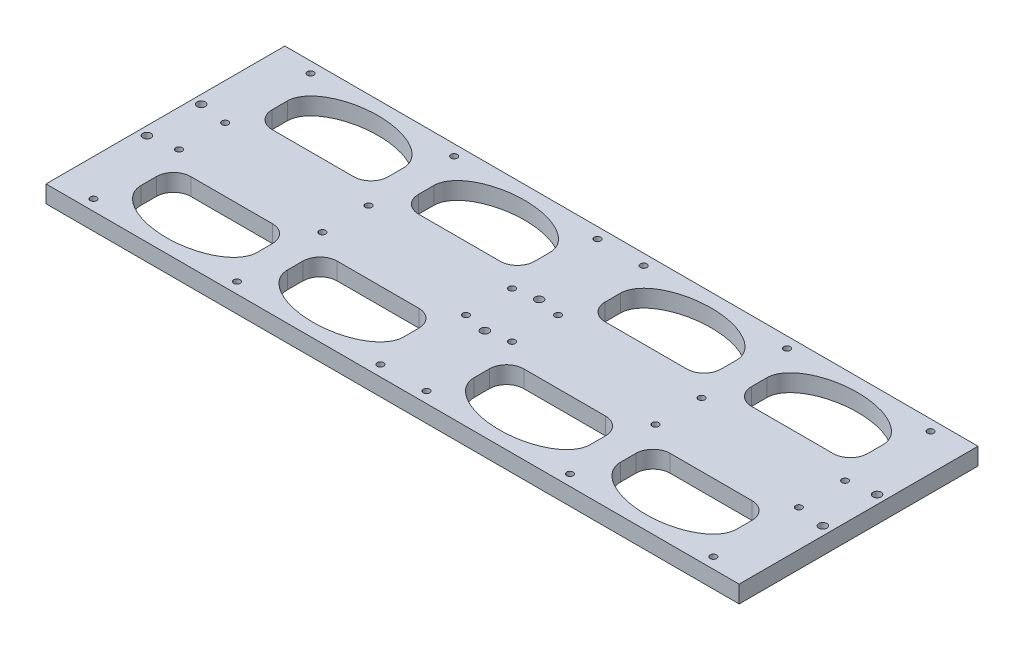
from build123d import *

# Parameters (mm, degrees)
SKETCH4_W                      = 118.3
SKETCH4_H                      = 40.5
BOSS_EXTRUDE1_DEPTH            = 12.7
CUT_EXTRUDE1_DEPTH             = 75.078168174
FILLET1_R                      = 3.175
LPATTERN1_COUNT                = 2
LPATTERN1_PITCH                = 27
FILLET1_OF_LPATTERN1_R         = 3.175
MIRROR1_DEPTH                  = 12.7
SKETCH8_R                      = 0.85
CUT_EXTRUDE2_DEPTH             = 75.078168329
MIRROR3_COPY_1_SKETCH_R        = 0.85
MIRROR3_COPY_1_DEPTH           = 75.078168329
SKETCH14_W                     = 118.3
SKETCH14_H                     = 0.96
SKETCH14_W_2                   = 4.5
SKETCH14_H_2                   = 40.5
CUT_EXTRUDE7_DEPTH             = 0.1
CUT_EXTRUDE8_DEPTH             = 2.35
MIRROR14_COPY_1_DEPTH          = 2.35
MIRROR16_COPY_1_DEPTH          = 2.35
MIRROR16_COPY_2_DEPTH          = 2.35
MIRROR16_COPY_3_DEPTH          = 2.35
CUT_EXTRUDE10_DEPTH            = 75.061089804
SKETCH20_W                     = 127.8
SKETCH20_H                     = 85.5
BOSS_EXTRUDE2_DEPTH            = 3.175
SKETCH22_W                     = 127.8
SKETCH22_H                     = 85.5
CUT_EXTRUDE11_DEPTH            = 78.923440062
CUT_EXTRUDE12_DEPTH            = 77.947080029
F_0_80_TAPPED_HOLE1_D          = 1.19126
MIRROR19_COPY_1_DEPTH          = 77.947080029
MIRROR19_COPY_2_D              = 1.19126
SKETCH26_W                     = 127.8
SKETCH26_H                     = 0.96
CUT_EXTRUDE13_DEPTH            = 3.175
SKETCH27_W                     = 127.8
SKETCH27_H                     = 0.96
CUT_EXTRUDE14_DEPTH            = 3.175
SKETCH29_W                     = 3.175
SKETCH29_H                     = 19.77
CUT_EXTRUDE15_DEPTH            = 0.82
F_1_64_TAPPED_HOLE1_AT_2_COUNT = 2
F_1_64_TAPPED_HOLE1_AT_2_PITCH = 10
SKETCH36_R                     = 0.8
CUT_EXTRUDE16_DEPTH            = 10
FILLET2_R                      = 1.5
FILLET3_R                      = 1.5
F_1_64_TAPPED_HOLE2_AT_2_COUNT = 2
F_1_64_TAPPED_HOLE2_AT_2_PITCH = 10
SKETCH39_W                     = 133.05709145
SKETCH39_H                     = 28.467786801
SKETCH39_W_2                   = 140.708632386
SKETCH39_H_2                   = 27.431216522
CUT_EXTRUDE17_DEPTH            = 10


# Read off the part's stored shape, not the designer's step: Mirror1
with BuildPart() as part:
    # Sketch4 → Boss-Extrude1 (new body)
    with BuildSketch(Plane(origin=(0, 0, 0), x_dir=(1, 0, 0), z_dir=(0, 1, 0))):
        with Locations((0, 22.5)):
            Rectangle(SKETCH4_W, SKETCH4_H)
    extrude(amount=BOSS_EXTRUDE1_DEPTH)

    # Sketch5 → Cut-Extrude1 (cut, through all)
    with BuildSketch(Plane(origin=(0, 12.7, 0), x_dir=(1, 0, 0), z_dir=(0, 1, 0))):
        with BuildLine():
            Line((-54.9, 13.5), (-54.9, 7.5))
            Line((-54.9, 7.5), (-33.5, 7.5))
            Line((-33.5, 7.5), (-33.5, 13.5))
            add(Edge.make_bspline(
                [(-33.5, 13.5), (-33.5, 19.5), (-44.2, 19.5), (-54.9, 19.5), (-54.9, 13.5)],
                knots=[3.141592654, 3.141592654, 3.141592654, 4.71238898, 4.71238898, 6.283185307, 6.283185307, 6.283185307], degree=2, weights=[1, 0.707106781, 1, 0.707106781, 1]))
        make_face()
        with BuildLine():
            Line((-54.9, 37.5), (-33.5, 37.5))
            Line((-33.5, 37.5), (-33.5, 31.5))
            add(Edge.make_bspline(
                [(-54.9, 31.5), (-54.9, 25.5), (-44.2, 25.5), (-33.5, 25.5), (-33.5, 31.5)],
                knots=[0, 0, 0, 1.570796327, 1.570796327, 3.141592654, 3.141592654, 3.141592654], degree=2, weights=[1, 0.707106781, 1, 0.707106781, 1]))
            Line((-54.9, 31.5), (-54.9, 37.5))
        make_face()
    cut_extrude1 = extrude(amount=-CUT_EXTRUDE1_DEPTH, mode=Mode.SUBTRACT)

    # Fillet1
    fillet1_edges = [part.edges().sort_by_distance(p)[0] for p in [
        (-33.5, 6.35, -7.5),
        (-54.9, 6.35, -7.5),
        (-54.9, 6.35, -37.5),
        (-33.5, 6.35, -37.5),
    ]]
    fillet(fillet1_edges, radius=FILLET1_R)

    # LPattern1: Cut-Extrude1 ×2
    with Locations(*[(i * LPATTERN1_PITCH, 0, 0) for i in range(1, LPATTERN1_COUNT)]):
        add(cut_extrude1, mode=Mode.SUBTRACT)

    # Fillet1 of LPattern1
    fillet1_of_lpattern1_edges = [part.edges().sort_by_distance(p)[0] for p in [
        (-6.5, 6.35, -7.5),
        (-27.9, 6.35, -7.5),
        (-27.9, 6.35, -37.5),
        (-6.5, 6.35, -37.5),
    ]]
    fillet(fillet1_of_lpattern1_edges, radius=FILLET1_OF_LPATTERN1_R)

    # Mirror1 outline → Mirror1 (cut)
    with BuildSketch(Plane(origin=(0, 0, 0), x_dir=(1, 0, 0), z_dir=(0, 1, 0))):
        with BuildLine():
            add(Edge.make_bspline(
                [(33.5, 13.5), (33.5, 19.5), (44.2, 19.5), (54.9, 19.5), (54.9, 13.5)],
                knots=[3.141592654, 3.141592654, 3.141592654, 4.71238898, 4.71238898, 6.283185307, 6.283185307, 6.283185307], degree=2, weights=[1, 0.707106781, 1, 0.707106781, 1]))
            Line((33.5, 13.5), (33.5, 10.675))
            ThreePointArc((33.5, 10.675), (34.42993597, 8.42993597), (36.675, 7.5))
            Line((36.675, 7.5), (51.725, 7.5))
            ThreePointArc((51.725, 7.5), (53.97006403, 8.42993597), (54.9, 10.675))
            Line((54.9, 10.675), (54.9, 13.5))
        make_face()
        with BuildLine():
            add(Edge.make_bspline(
                [(54.9, 31.5), (54.9, 25.5), (44.2, 25.5), (33.5, 25.5), (33.5, 31.5)],
                knots=[0, 0, 0, 1.570796327, 1.570796327, 3.141592654, 3.141592654, 3.141592654], degree=2, weights=[1, 0.707106781, 1, 0.707106781, 1]))
            Line((54.9, 31.5), (54.9, 34.325))
            ThreePointArc((54.9, 34.325), (53.97006403, 36.57006403), (51.725, 37.5))
            Line((51.725, 37.5), (36.675, 37.5))
            ThreePointArc((36.675, 37.5), (34.42993597, 36.57006403), (33.5, 34.325))
            Line((33.5, 34.325), (33.5, 31.5))
        make_face()
        with BuildLine():
            add(Edge.make_bspline(
                [(6.5, 13.5), (6.5, 19.5), (17.2, 19.5), (27.9, 19.5), (27.9, 13.5)],
                knots=[3.141592654, 3.141592654, 3.141592654, 4.71238898, 4.71238898, 6.283185307, 6.283185307, 6.283185307], degree=2, weights=[1, 0.707106781, 1, 0.707106781, 1]))
            Line((6.5, 13.5), (6.5, 10.675))
            ThreePointArc((6.5, 10.675), (7.42993597, 8.42993597), (9.675, 7.5))
            Line((9.675, 7.5), (24.725, 7.5))
            ThreePointArc((24.725, 7.5), (26.97006403, 8.42993597), (27.9, 10.675))
            Line((27.9, 10.675), (27.9, 13.5))
        make_face()
        with BuildLine():
            add(Edge.make_bspline(
                [(27.9, 31.5), (27.9, 25.5), (17.2, 25.5), (6.5, 25.5), (6.5, 31.5)],
                knots=[0, 0, 0, 1.570796327, 1.570796327, 3.141592654, 3.141592654, 3.141592654], degree=2, weights=[1, 0.707106781, 1, 0.707106781, 1]))
            Line((27.9, 31.5), (27.9, 34.325))
            ThreePointArc((27.9, 34.325), (26.97006403, 36.57006403), (24.725, 37.5))
            Line((24.725, 37.5), (9.675, 37.5))
            ThreePointArc((9.675, 37.5), (7.42993597, 36.57006403), (6.5, 34.325))
            Line((6.5, 34.325), (6.5, 31.5))
        make_face()
    extrude(amount=MIRROR1_DEPTH, mode=Mode.SUBTRACT)

    # Sketch8 → Cut-Extrude2 (cut, through all)
    with BuildSketch(Plane(origin=(0, 12.7, 0), x_dir=(1, 0, 0), z_dir=(0, 1, 0))):
        with Locations(Location((-57.15, 40.75, 0), (0, 0, 270))):
            Circle(SKETCH8_R)
        with Locations(Location((-30.7, 40.75, 0), (0, 0, 270))):
            Circle(SKETCH8_R)
        with Locations(Location((-4.25, 40.75, 0), (0, 0, 270))):
            Circle(SKETCH8_R)
        with Locations(Location((-4.25, 24.98, 0), (0, 0, 270))):
            Circle(SKETCH8_R)
        with Locations(Location((-30.7, 24.98, 0), (0, 0, 270))):
            Circle(SKETCH8_R)
        with Locations(Location((-57.15, 24.98, 0), (0, 0, 270))):
            Circle(SKETCH8_R)
    cut_extrude2 = extrude(amount=-CUT_EXTRUDE2_DEPTH, mode=Mode.SUBTRACT)

    # Mirror2: Cut-Extrude2 across plane
    add(cut_extrude2.mirror(Plane.XY.offset(-22.5)), mode=Mode.SUBTRACT)

    # Mirror3: Cut-Extrude2 across plane
    add(cut_extrude2.mirror(Plane(origin=(0, 0, 0), x_dir=(0, 0, 1), z_dir=(1, 0, 0))), mode=Mode.SUBTRACT)

    # Mirror3 copy 1 sketch → Mirror3 copy 1 (cut, through all)
    with BuildSketch(Plane(origin=(0, 12.7, -45), x_dir=(-1, 0, 0), z_dir=(0, 1, 0))):
        with Locations(Location((-57.15, 40.75, 0), (0, 0, 270))):
            Circle(MIRROR3_COPY_1_SKETCH_R)
        with Locations(Location((-30.7, 40.75, 0), (0, 0, 270))):
            Circle(MIRROR3_COPY_1_SKETCH_R)
        with Locations(Location((-4.25, 40.75, 0), (0, 0, 270))):
            Circle(MIRROR3_COPY_1_SKETCH_R)
        with Locations(Location((-4.25, 24.98, 0), (0, 0, 270))):
            Circle(MIRROR3_COPY_1_SKETCH_R)
        with Locations(Location((-30.7, 24.98, 0), (0, 0, 270))):
            Circle(MIRROR3_COPY_1_SKETCH_R)
        with Locations(Location((-57.15, 24.98, 0), (0, 0, 270))):
            Circle(MIRROR3_COPY_1_SKETCH_R)
    extrude(amount=-MIRROR3_COPY_1_DEPTH, mode=Mode.SUBTRACT)

    # Sketch14 → Cut-Extrude7 (cut)
    with BuildSketch(Plane(origin=(0, 12.7, 0), x_dir=(1, 0, 0), z_dir=(0, 1, 0))):
        with Locations((0, 22.5)):
            Rectangle(SKETCH14_W, SKETCH14_H)
        with Locations((0, 22.5)):
            Rectangle(SKETCH14_W_2, SKETCH14_H_2)
    extrude(amount=-CUT_EXTRUDE7_DEPTH, mode=Mode.SUBTRACT)

    # Sketch15 → Cut-Extrude8 (cut)
    with BuildSketch(Plane(origin=(0, 12.7, 0), x_dir=(1, 0, 0), z_dir=(0, 1, 0))):
        with BuildLine():
            Line((-33.875, 42.75), (-27.525, 42.75))
            Line((-27.525, 42.75), (-27.525, 41.5))
            ThreePointArc((-27.525, 41.5), (-30.7, 38.325), (-33.875, 41.5))
            Line((-33.875, 41.5), (-33.875, 42.75))
        make_face()
        with BuildLine():
            Line((-2.25, 42.75), (-6.675, 42.75))
            Line((-6.675, 42.75), (-6.675, 41.5))
            ThreePointArc((-6.675, 41.5), (-5.74506403, 39.25493597), (-3.5, 38.325))
            Line((-3.5, 38.325), (-2.25, 38.325))
            Line((-2.25, 38.325), (-2.25, 42.75))
        make_face()
        with BuildLine():
            Line((-59.15, 42.75), (-54.725, 42.75))
            Line((-54.725, 42.75), (-54.725, 41.5))
            ThreePointArc((-54.725, 41.5), (-55.65493597, 39.25493597), (-57.9, 38.325))
            Line((-57.9, 38.325), (-59.15, 38.325))
            Line((-59.15, 38.325), (-59.15, 42.75))
        make_face()
    cut_extrude8 = extrude(amount=-CUT_EXTRUDE8_DEPTH, mode=Mode.SUBTRACT)

    # Mirror6: Cut-Extrude8 across plane
    add(cut_extrude8.mirror(Plane(origin=(0, 0, -32.865), x_dir=(1, 0, 0), z_dir=(0, 0, -1))), mode=Mode.SUBTRACT)

    # Mirror14: Cut-Extrude8 across plane
    add(cut_extrude8.mirror(Plane(origin=(0, 0, 0), x_dir=(0, 0, 1), z_dir=(1, 0, 0))), mode=Mode.SUBTRACT)

    # Mirror14 copy 1 sketch → Mirror14 copy 1 (cut)
    with BuildSketch(Plane(origin=(0, 12.7, -65.73), x_dir=(-1, 0, 0), z_dir=(0, 1, 0))):
        with BuildLine():
            Line((-33.875, 42.75), (-27.525, 42.75))
            Line((-27.525, 42.75), (-27.525, 41.5))
            ThreePointArc((-27.525, 41.5), (-30.7, 38.325), (-33.875, 41.5))
            Line((-33.875, 41.5), (-33.875, 42.75))
        make_face()
        with BuildLine():
            Line((-2.25, 42.75), (-6.675, 42.75))
            Line((-6.675, 42.75), (-6.675, 41.5))
            ThreePointArc((-6.675, 41.5), (-5.74506403, 39.25493597), (-3.5, 38.325))
            Line((-3.5, 38.325), (-2.25, 38.325))
            Line((-2.25, 38.325), (-2.25, 42.75))
        make_face()
        with BuildLine():
            Line((-59.15, 42.75), (-54.725, 42.75))
            Line((-54.725, 42.75), (-54.725, 41.5))
            ThreePointArc((-54.725, 41.5), (-55.65493597, 39.25493597), (-57.9, 38.325))
            Line((-57.9, 38.325), (-59.15, 38.325))
            Line((-59.15, 38.325), (-59.15, 42.75))
        make_face()
    extrude(amount=-MIRROR14_COPY_1_DEPTH, mode=Mode.SUBTRACT)

    # Mirror16: Cut-Extrude8 across plane
    add(cut_extrude8.mirror(Plane.XY.offset(-22.5)), mode=Mode.SUBTRACT)

    # Mirror16 copy 1 sketch → Mirror16 copy 1 (cut)
    with BuildSketch(Plane(origin=(0, 12.7, 20.73), x_dir=(1, 0, 0), z_dir=(0, 1, 0))):
        with BuildLine():
            Line((-33.875, 42.75), (-27.525, 42.75))
            Line((-27.525, 42.75), (-27.525, 41.5))
            ThreePointArc((-27.525, 41.5), (-30.7, 38.325), (-33.875, 41.5))
            Line((-33.875, 41.5), (-33.875, 42.75))
        make_face()
        with BuildLine():
            Line((-2.25, 42.75), (-6.675, 42.75))
            Line((-6.675, 42.75), (-6.675, 41.5))
            ThreePointArc((-6.675, 41.5), (-5.74506403, 39.25493597), (-3.5, 38.325))
            Line((-3.5, 38.325), (-2.25, 38.325))
            Line((-2.25, 38.325), (-2.25, 42.75))
        make_face()
        with BuildLine():
            Line((-59.15, 42.75), (-54.725, 42.75))
            Line((-54.725, 42.75), (-54.725, 41.5))
            ThreePointArc((-54.725, 41.5), (-55.65493597, 39.25493597), (-57.9, 38.325))
            Line((-57.9, 38.325), (-59.15, 38.325))
            Line((-59.15, 38.325), (-59.15, 42.75))
        make_face()
    extrude(amount=-MIRROR16_COPY_1_DEPTH, mode=Mode.SUBTRACT)

    # Mirror16 copy 2 sketch → Mirror16 copy 2 (cut)
    with BuildSketch(Plane(origin=(0, 12.7, -45), x_dir=(-1, 0, 0), z_dir=(0, 1, 0))):
        with BuildLine():
            Line((-33.875, 42.75), (-27.525, 42.75))
            Line((-27.525, 42.75), (-27.525, 41.5))
            ThreePointArc((-27.525, 41.5), (-30.7, 38.325), (-33.875, 41.5))
            Line((-33.875, 41.5), (-33.875, 42.75))
        make_face()
        with BuildLine():
            Line((-2.25, 42.75), (-6.675, 42.75))
            Line((-6.675, 42.75), (-6.675, 41.5))
            ThreePointArc((-6.675, 41.5), (-5.74506403, 39.25493597), (-3.5, 38.325))
            Line((-3.5, 38.325), (-2.25, 38.325))
            Line((-2.25, 38.325), (-2.25, 42.75))
        make_face()
        with BuildLine():
            Line((-59.15, 42.75), (-54.725, 42.75))
            Line((-54.725, 42.75), (-54.725, 41.5))
            ThreePointArc((-54.725, 41.5), (-55.65493597, 39.25493597), (-57.9, 38.325))
            Line((-57.9, 38.325), (-59.15, 38.325))
            Line((-59.15, 38.325), (-59.15, 42.75))
        make_face()
    extrude(amount=-MIRROR16_COPY_2_DEPTH, mode=Mode.SUBTRACT)

    # Mirror16 copy 3 sketch → Mirror16 copy 3 (cut)
    with BuildSketch(Plane(origin=(0, 12.7, 20.73), x_dir=(-1, 0, 0), z_dir=(0, 1, 0))):
        with BuildLine():
            Line((-33.875, -42.75), (-27.525, -42.75))
            Line((-27.525, -42.75), (-27.525, -41.5))
            ThreePointArc((-27.525, -41.5), (-30.7, -38.325), (-33.875, -41.5))
            Line((-33.875, -41.5), (-33.875, -42.75))
        make_face()
        with BuildLine():
            Line((-2.25, -42.75), (-6.675, -42.75))
            Line((-6.675, -42.75), (-6.675, -41.5))
            ThreePointArc((-6.675, -41.5), (-5.74506403, -39.25493597), (-3.5, -38.325))
            Line((-3.5, -38.325), (-2.25, -38.325))
            Line((-2.25, -38.325), (-2.25, -42.75))
        make_face()
        with BuildLine():
            Line((-59.15, -42.75), (-54.725, -42.75))
            Line((-54.725, -42.75), (-54.725, -41.5))
            ThreePointArc((-54.725, -41.5), (-55.65493597, -39.25493597), (-57.9, -38.325))
            Line((-57.9, -38.325), (-59.15, -38.325))
            Line((-59.15, -38.325), (-59.15, -42.75))
        make_face()
    extrude(amount=-MIRROR16_COPY_3_DEPTH, mode=Mode.SUBTRACT)

    # Sketch17 → Cut-Extrude10 (cut, through all)
    with BuildSketch(Plane(origin=(0, 12.6, 0), x_dir=(1, 0, 0), z_dir=(0, 1, 0))):
        Polygon((-54.725, 22.98), (-59.15, 22.98), (-59.15, 22.02), (-54.725, 22.02), (-33.875, 22.02), (-27.525, 22.02), (-6.675, 22.02), (-2.25, 22.02), (-2.25, 17.595), (-2.25, 6.675), (-2.25, 2.25), (2.25, 2.25), (2.25, 6.675), (2.25, 17.595), (2.25, 22.02), (6.675, 22.02), (27.525, 22.02), (33.875, 22.02), (54.725, 22.02), (59.15, 22.02), (59.15, 22.98), (54.725, 22.98), (33.875, 22.98), (27.525, 22.98), (6.675, 22.98), (2.25, 22.98), (2.25, 27.405), (2.25, 38.325), (2.25, 42.75), (-2.25, 42.75), (-2.25, 38.325), (-2.25, 27.405), (-2.25, 22.98), (-6.675, 22.98), (-27.525, 22.98), (-33.875, 22.98), align=None)
    extrude(amount=-CUT_EXTRUDE10_DEPTH, mode=Mode.SUBTRACT)


with BuildPart() as cut_extrude10_piece_1:
    # of the separate pieces the step leaves, piece 1, a body of its own (cut_extrude10_pieces)
    add(part.part.solids().sort_by_distance((59.15, 0, -22.02))[0])



with BuildPart() as cut_extrude10_piece_2:
    # of the separate pieces the step leaves, piece 2, a body of its own (cut_extrude10_pieces)
    add(part.part.solids().sort_by_distance((2.25, 0, -42.75))[0])


with BuildPart() as cut_extrude10_piece_3:
    # of the separate pieces the step leaves, piece 3, a body of its own (cut_extrude10_pieces)
    add(part.part.solids().sort_by_distance((-59.15, 0, -2.25))[0])


with BuildPart() as cut_extrude10_piece_4:
    # of the separate pieces the step leaves, piece 4, a body of its own (cut_extrude10_pieces)
    add(part.part.solids().sort_by_distance((-59.15, 0, -22.98))[0])


with BuildPart() as cut_extrude10_piece_1_1:
    add(cut_extrude10_piece_1.part)

    add(cut_extrude10_piece_2.part)  # Boss-Extrude2 merges Cut-Extrude10 piece 2

    add(cut_extrude10_piece_3.part)  # Boss-Extrude2 merges Cut-Extrude10 piece 3

    add(cut_extrude10_piece_4.part)  # Boss-Extrude2 merges Cut-Extrude10 piece 4
    # Sketch20 → Boss-Extrude2 (add)
    with BuildSketch(Plane(origin=(0, 0, 0), x_dir=(1, 0, 0), z_dir=(0, 1, 0))):
        Rectangle(SKETCH20_W, SKETCH20_H)
    extrude(amount=-BOSS_EXTRUDE2_DEPTH)

    # Sketch22 → Cut-Extrude11 (cut, through all)
    with BuildSketch(Plane(origin=(0, 0, 0), x_dir=(1, 0, 0), z_dir=(0, 1, 0))):
        Rectangle(SKETCH22_W, SKETCH22_H)
    extrude(amount=CUT_EXTRUDE11_DEPTH, mode=Mode.SUBTRACT)

    # Sketch23 → Cut-Extrude12 (cut, through all)
    with BuildSketch(Plane(origin=(0, 0, 0), x_dir=(1, 0, 0), z_dir=(0, 1, 0))):
        with BuildLine():
            Line((-36.675, 37.5), (-51.725, 37.5))
            ThreePointArc((-51.725, 37.5), (-53.97006403, 36.57006403), (-54.9, 34.325))
            Line((-54.9, 34.325), (-54.9, 31.5))
            add(Edge.make_bspline(
                [(-54.9, 31.5), (-54.9, 25.5), (-44.2, 25.5), (-33.5, 25.5), (-33.5, 31.5)],
                knots=[0, 0, 0, 1.570796327, 1.570796327, 3.141592654, 3.141592654, 3.141592654], degree=2, weights=[1, 0.707106781, 1, 0.707106781, 1]))
            Line((-33.5, 31.5), (-33.5, 34.325))
            ThreePointArc((-33.5, 34.325), (-34.42993597, 36.57006403), (-36.675, 37.5))
        make_face()
        with BuildLine():
            Line((-9.675, 37.5), (-24.725, 37.5))
            ThreePointArc((-24.725, 37.5), (-26.97006403, 36.57006403), (-27.9, 34.325))
            Line((-27.9, 34.325), (-27.9, 31.5))
            add(Edge.make_bspline(
                [(-27.9, 31.5), (-27.9, 25.5), (-17.2, 25.5), (-6.5, 25.5), (-6.5, 31.5)],
                knots=[0, 0, 0, 1.570796327, 1.570796327, 3.141592654, 3.141592654, 3.141592654], degree=2, weights=[1, 0.707106781, 1, 0.707106781, 1]))
            Line((-6.5, 31.5), (-6.5, 34.325))
            ThreePointArc((-6.5, 34.325), (-7.42993597, 36.57006403), (-9.675, 37.5))
        make_face()
        with BuildLine():
            Line((-54.9, 13.5), (-54.9, 10.675))
            ThreePointArc((-54.9, 10.675), (-53.97006403, 8.42993597), (-51.725, 7.5))
            Line((-51.725, 7.5), (-36.675, 7.5))
            ThreePointArc((-36.675, 7.5), (-34.42993597, 8.42993597), (-33.5, 10.675))
            Line((-33.5, 10.675), (-33.5, 13.5))
            add(Edge.make_bspline(
                [(-33.5, 13.5), (-33.5, 19.5), (-44.2, 19.5), (-54.9, 19.5), (-54.9, 13.5)],
                knots=[3.141592654, 3.141592654, 3.141592654, 4.71238898, 4.71238898, 6.283185307, 6.283185307, 6.283185307], degree=2, weights=[1, 0.707106781, 1, 0.707106781, 1]))
        make_face()
        with BuildLine():
            Line((-27.9, 13.5), (-27.9, 10.675))
            ThreePointArc((-27.9, 10.675), (-26.97006403, 8.42993597), (-24.725, 7.5))
            Line((-24.725, 7.5), (-9.675, 7.5))
            ThreePointArc((-9.675, 7.5), (-7.42993597, 8.42993597), (-6.5, 10.675))
            Line((-6.5, 10.675), (-6.5, 13.5))
            add(Edge.make_bspline(
                [(-6.5, 13.5), (-6.5, 19.5), (-17.2, 19.5), (-27.9, 19.5), (-27.9, 13.5)],
                knots=[3.141592654, 3.141592654, 3.141592654, 4.71238898, 4.71238898, 6.283185307, 6.283185307, 6.283185307], degree=2, weights=[1, 0.707106781, 1, 0.707106781, 1]))
        make_face()
    cut_extrude12 = extrude(amount=-CUT_EXTRUDE12_DEPTH, mode=Mode.SUBTRACT)

    # #0-80 Tapped Hole1 (through all)
    with Locations(Plane(origin=(0, 0, 0), x_dir=(1, 0, 0), z_dir=(0, 1, 0))):
        with Locations((-57.15, 40.75), (-30.7, 40.75), (-4.25, 40.75), (-4.25, 24.98), (-30.7, 24.98), (-30.7, 20.02), (-57.15, 24.98), (-57.15, 20.02), (-4.25, 20.02), (-4.25, 4.25), (-30.7, 4.25), (-57.15, 4.25)):
            f_0_80_tapped_hole1 = Hole(F_0_80_TAPPED_HOLE1_D / 2)

    # Mirror18: Cut-Extrude12, #0-80 Tapped Hole1 across plane
    add(cut_extrude12.mirror(Plane(origin=(0, 0, 0), x_dir=(0, 0, 1), z_dir=(1, 0, 0))), mode=Mode.SUBTRACT)
    add(f_0_80_tapped_hole1.mirror(Plane(origin=(0, 0, 0), x_dir=(0, 0, 1), z_dir=(1, 0, 0))), mode=Mode.SUBTRACT)

    # Mirror19: Cut-Extrude12, #0-80 Tapped Hole1 across plane
    add(cut_extrude12.mirror(Plane(origin=(0, 0, 0), x_dir=(1, 0, 0), z_dir=(0, 0, -1))), mode=Mode.SUBTRACT)
    add(f_0_80_tapped_hole1.mirror(Plane(origin=(0, 0, 0), x_dir=(1, 0, 0), z_dir=(0, 0, -1))), mode=Mode.SUBTRACT)

    # Mirror19 copy 1 sketch → Mirror19 copy 1 (cut, through all)
    with BuildSketch(Plane(origin=(0, 0, 0), x_dir=(-1, 0, 0), z_dir=(0, 1, 0))):
        with BuildLine():
            Line((-36.675, 37.5), (-51.725, 37.5))
            ThreePointArc((-51.725, 37.5), (-53.97006403, 36.57006403), (-54.9, 34.325))
            Line((-54.9, 34.325), (-54.9, 31.5))
            add(Edge.make_bspline(
                [(-54.9, 31.5), (-54.9, 25.5), (-44.2, 25.5), (-33.5, 25.5), (-33.5, 31.5)],
                knots=[0, 0, 0, 1.570796327, 1.570796327, 3.141592654, 3.141592654, 3.141592654], degree=2, weights=[1, 0.707106781, 1, 0.707106781, 1]))
            Line((-33.5, 31.5), (-33.5, 34.325))
            ThreePointArc((-33.5, 34.325), (-34.42993597, 36.57006403), (-36.675, 37.5))
        make_face()
        with BuildLine():
            Line((-9.675, 37.5), (-24.725, 37.5))
            ThreePointArc((-24.725, 37.5), (-26.97006403, 36.57006403), (-27.9, 34.325))
            Line((-27.9, 34.325), (-27.9, 31.5))
            add(Edge.make_bspline(
                [(-27.9, 31.5), (-27.9, 25.5), (-17.2, 25.5), (-6.5, 25.5), (-6.5, 31.5)],
                knots=[0, 0, 0, 1.570796327, 1.570796327, 3.141592654, 3.141592654, 3.141592654], degree=2, weights=[1, 0.707106781, 1, 0.707106781, 1]))
            Line((-6.5, 31.5), (-6.5, 34.325))
            ThreePointArc((-6.5, 34.325), (-7.42993597, 36.57006403), (-9.675, 37.5))
        make_face()
        with BuildLine():
            Line((-54.9, 13.5), (-54.9, 10.675))
            ThreePointArc((-54.9, 10.675), (-53.97006403, 8.42993597), (-51.725, 7.5))
            Line((-51.725, 7.5), (-36.675, 7.5))
            ThreePointArc((-36.675, 7.5), (-34.42993597, 8.42993597), (-33.5, 10.675))
            Line((-33.5, 10.675), (-33.5, 13.5))
            add(Edge.make_bspline(
                [(-33.5, 13.5), (-33.5, 19.5), (-44.2, 19.5), (-54.9, 19.5), (-54.9, 13.5)],
                knots=[3.141592654, 3.141592654, 3.141592654, 4.71238898, 4.71238898, 6.283185307, 6.283185307, 6.283185307], degree=2, weights=[1, 0.707106781, 1, 0.707106781, 1]))
        make_face()
        with BuildLine():
            Line((-27.9, 13.5), (-27.9, 10.675))
            ThreePointArc((-27.9, 10.675), (-26.97006403, 8.42993597), (-24.725, 7.5))
            Line((-24.725, 7.5), (-9.675, 7.5))
            ThreePointArc((-9.675, 7.5), (-7.42993597, 8.42993597), (-6.5, 10.675))
            Line((-6.5, 10.675), (-6.5, 13.5))
            add(Edge.make_bspline(
                [(-6.5, 13.5), (-6.5, 19.5), (-17.2, 19.5), (-27.9, 19.5), (-27.9, 13.5)],
                knots=[3.141592654, 3.141592654, 3.141592654, 4.71238898, 4.71238898, 6.283185307, 6.283185307, 6.283185307], degree=2, weights=[1, 0.707106781, 1, 0.707106781, 1]))
        make_face()
    extrude(amount=-MIRROR19_COPY_1_DEPTH, mode=Mode.SUBTRACT)

    # Mirror19 copy 2 (through all)
    with Locations(Plane(origin=(0, 0, 0), x_dir=(-1, 0, 0), z_dir=(0, 1, 0))):
        with Locations((-57.15, 40.75), (-30.7, 40.75), (-4.25, 40.75), (-4.25, 24.98), (-30.7, 24.98), (-30.7, 20.02), (-57.15, 24.98), (-57.15, 20.02), (-4.25, 20.02), (-4.25, 4.25), (-30.7, 4.25), (-57.15, 4.25)):
            Hole(MIRROR19_COPY_2_D / 2)

    # Sketch26 → Cut-Extrude13 (cut)
    with BuildSketch(Plane(origin=(0, 0, 0), x_dir=(1, 0, 0), z_dir=(0, 1, 0))):
        with Locations((0, 22.5)):
            Rectangle(SKETCH26_W, SKETCH26_H)
    extrude(amount=-CUT_EXTRUDE13_DEPTH, mode=Mode.SUBTRACT)


with BuildPart() as cut_extrude13_piece_1:
    # of the separate pieces the step leaves, piece 1, a body of its own (cut_extrude13_pieces)
    add(cut_extrude10_piece_1_1.part.solids().sort_by_distance((63.9, 0, -22.02))[0])

    # Sketch27 → Cut-Extrude14 (cut)
    with BuildSketch(Plane(origin=(0, 0, 0), x_dir=(1, 0, 0), z_dir=(0, 1, 0))):
        with Locations((0, -22.5)):
            Rectangle(SKETCH27_W, SKETCH27_H)
    extrude(amount=-CUT_EXTRUDE14_DEPTH, mode=Mode.SUBTRACT)


with BuildPart() as cut_extrude13_piece_2:
    # of the separate pieces the step leaves, piece 2, a body of its own (cut_extrude13_pieces)
    add(cut_extrude10_piece_1_1.part.solids().sort_by_distance((-63.9, 0, -42.75))[0])


with BuildPart() as cut_extrude14_piece_1:
    # of the separate pieces the step leaves, piece 1, a body of its own (cut_extrude14_pieces)
    add(cut_extrude13_piece_1.part.solids().sort_by_distance((63.9, 0, -22.02))[0])

    # Sketch30 → #1-64 Tapped Hole1 (revolve, cut)
    with BuildSketch(Plane(origin=(62.3125, 0, -5), x_dir=(0, 0, 1), z_dir=(1, 0, 0))):
        Polygon((0, 0), (0, 6.144040327), (0.75565, 5.69), (0.75565, 0), align=None)
    f_1_64_tapped_hole1 = revolve(axis=Axis((62.3125, 6.35, -5), (0, -1, 0)), mode=Mode.SUBTRACT)

    # #1-64 Tapped Hole1 at 2: #1-64 Tapped Hole1 ×2
    with Locations(*[(0, 0, i * F_1_64_TAPPED_HOLE1_AT_2_PITCH) for i in range(1, F_1_64_TAPPED_HOLE1_AT_2_COUNT)]):
        add(f_1_64_tapped_hole1, mode=Mode.SUBTRACT)


with BuildPart() as cut_extrude14_piece_2:
    # of the separate pieces the step leaves, piece 2, a body of its own (cut_extrude14_pieces)
    add(cut_extrude13_piece_1.part.solids().sort_by_distance((63.9, 0, 22.98))[0])


with BuildPart() as cut_extrude15_tool:
    # Sketch29 → Cut-Extrude15 (new body)
    with BuildSketch(Plane.XZ.offset(3.175)):
        with Locations((62.3125, -32.865)):
            Rectangle(SKETCH29_W, SKETCH29_H)
        with Locations((62.3125, 32.865)):
            Rectangle(SKETCH29_W, SKETCH29_H)
    cut_extrude15 = extrude(amount=-CUT_EXTRUDE15_DEPTH)


with BuildPart() as cut_extrude13_piece_2_1:
    add(cut_extrude13_piece_2.part)

    # Cut-Extrude15: cut by cut_extrude15_tool
    add(cut_extrude15_tool.part, mode=Mode.SUBTRACT)


with BuildPart() as cut_extrude14_piece_2_1:
    add(cut_extrude14_piece_2.part)

    # Cut-Extrude15: cut by cut_extrude15_tool
    add(cut_extrude15_tool.part, mode=Mode.SUBTRACT)


with BuildPart() as cut_extrude16_tool:
    # Sketch36 → Cut-Extrude16 (new body)
    with BuildSketch(Plane.XZ.offset(2.355)):
        with Locations(Location((62.3125, 37.98, 0), (0, 0, 270))):
            Circle(SKETCH36_R)
        with Locations(Location((62.3125, 25.98, 0), (0, 0, 270))):
            Circle(SKETCH36_R)
        with Locations(Location((62.3125, -25.98, 0), (0, 0, 270))):
            Circle(SKETCH36_R)
        with Locations(Location((62.3125, -37.98, 0), (0, 0, 270))):
            Circle(SKETCH36_R)
    cut_extrude16 = extrude(amount=-CUT_EXTRUDE16_DEPTH)


with BuildPart() as cut_extrude13_piece_2_2:
    add(cut_extrude13_piece_2_1.part)

    # Cut-Extrude16: cut by cut_extrude16_tool
    add(cut_extrude16_tool.part, mode=Mode.SUBTRACT)


with BuildPart() as cut_extrude14_piece_2_2:
    add(cut_extrude14_piece_2_1.part)

    # Cut-Extrude16: cut by cut_extrude16_tool
    add(cut_extrude16_tool.part, mode=Mode.SUBTRACT)


with BuildPart() as mirror20_tool:
    # Mirror20: Cut-Extrude15, #1-64 Tapped Hole1, Cut-Extrude16 across plane
    add(cut_extrude15.mirror(Plane(origin=(0, 0, 0), x_dir=(0, 0, 1), z_dir=(1, 0, 0))))
    add(f_1_64_tapped_hole1.mirror(Plane(origin=(0, 0, 0), x_dir=(0, 0, 1), z_dir=(1, 0, 0))))
    add(cut_extrude16.mirror(Plane(origin=(0, 0, 0), x_dir=(0, 0, 1), z_dir=(1, 0, 0))))


with BuildPart() as cut_extrude13_piece_2_3:
    add(cut_extrude13_piece_2_2.part)

    # Mirror20: cut by mirror20_tool
    add(mirror20_tool.part, mode=Mode.SUBTRACT)

    # Fillet2
    fillet2_edges = [cut_extrude13_piece_2_3.edges().sort_by_distance(p)[0] for p in [
        (-63.9, -1.1775, -42.75),
        (63.9, -1.1775, -42.75),
    ]]
    fillet(fillet2_edges, radius=FILLET2_R)


with BuildPart() as cut_extrude14_piece_1_1:
    add(cut_extrude14_piece_1.part)

    # Mirror20: cut by mirror20_tool
    add(mirror20_tool.part, mode=Mode.SUBTRACT)

    # Mirror20 copy 1 sketch → Mirror20 copy 1 (revolve, cut)
    with BuildSketch(Plane(origin=(-62.3125, 0, 5), x_dir=(0, 0, 1), z_dir=(-1, 0, 0))):
        Polygon((0, 0), (0, -6.144040327), (0.75565, -5.69), (0.75565, 0), align=None)
    revolve(axis=Axis((-62.3125, 6.35, 5), (0, 1, 0)), mode=Mode.SUBTRACT)

    # Sketch37 → #1-64 Tapped Hole2 (revolve, cut)
    with BuildSketch(Plane(origin=(0, 0, -5), x_dir=(0, 0, 1), z_dir=(1, 0, 0))):
        Polygon((0, 0), (0, 6.144040327), (0.75565, 5.69), (0.75565, 0), align=None)
    f_1_64_tapped_hole2 = revolve(axis=Axis((0, 6.35, -5), (0, -1, 0)), mode=Mode.SUBTRACT)

    # #1-64 Tapped Hole2 at 2: #1-64 Tapped Hole2 ×2
    with Locations(*[(0, 0, i * F_1_64_TAPPED_HOLE2_AT_2_PITCH) for i in range(1, F_1_64_TAPPED_HOLE2_AT_2_COUNT)]):
        add(f_1_64_tapped_hole2, mode=Mode.SUBTRACT)


with BuildPart() as cut_extrude14_piece_2_3:
    add(cut_extrude14_piece_2_2.part)

    # Mirror20: cut by mirror20_tool
    add(mirror20_tool.part, mode=Mode.SUBTRACT)

    # Fillet3
    fillet3_edges = [cut_extrude14_piece_2_3.edges().sort_by_distance(p)[0] for p in [
        (63.9, -1.1775, 42.75),
        (-63.9, -1.1775, 42.75),
    ]]
    fillet(fillet3_edges, radius=FILLET3_R)


with BuildPart() as cut_extrude17_tool:
    # Sketch39 → Cut-Extrude17 (new body)
    with BuildSketch(Plane(origin=(0, 0, 0), x_dir=(1, 0, 0), z_dir=(0, 1, 0))):
        with Locations((2.628545725, 37.213893401)):
            Rectangle(SKETCH39_W, SKETCH39_H)
        with Locations((6.454316193, -36.695608261)):
            Rectangle(SKETCH39_W_2, SKETCH39_H_2)
    extrude(amount=-CUT_EXTRUDE17_DEPTH)


with BuildPart() as cut_extrude13_piece_2_4:
    add(cut_extrude13_piece_2_3.part)

    # Cut-Extrude17: cut by cut_extrude17_tool
    add(cut_extrude17_tool.part, mode=Mode.SUBTRACT)


with BuildPart() as cut_extrude14_piece_2_4:
    add(cut_extrude14_piece_2_3.part)

    # Cut-Extrude17: cut by cut_extrude17_tool
    add(cut_extrude17_tool.part, mode=Mode.SUBTRACT)


solid = cut_extrude14_piece_1_1.part
